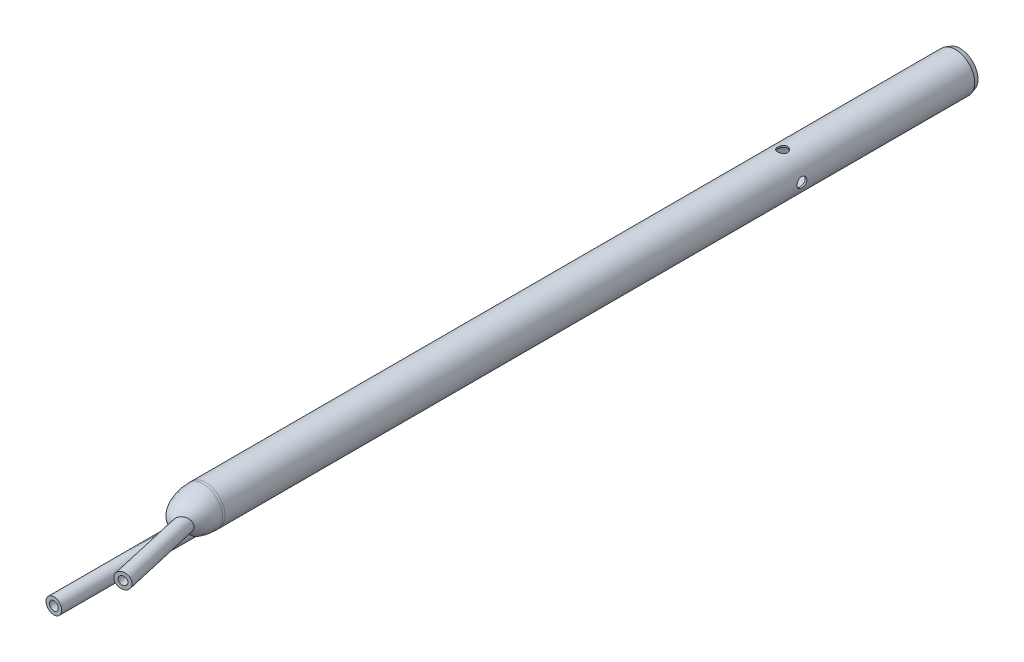
from build123d import *
from build123d.topology import SkipClean

# Parameters (mm, degrees)
SKETCH1_R               = 2.0066
SKETCH1_R_2             = 1.8415
BOSS_EXTRUDE1_DEPTH     = 77.724
CUT_EXTRUDE1_REACH      = 79.883
CUT_EXTRUDE1_END_RADIUS = 1.8415
SKETCH2_R               = 0.508
CIRPATTERN1_COUNT       = 4
SKETCH3_R               = 0.9271
SKETCH3_R_2             = 0.5715
BOSS_EXTRUDE2_DEPTH     = 77.724
CUT_EXTRUDE2_REACH      = 80.283
SKETCH6_R               = 0.5715
SKETCH7_R               = 0.8128
SKETCH7_R_2             = 0.4572
BOSS_EXTRUDE3_DEPTH     = 15.9766
SKETCH9_R               = 0.7874
SKETCH9_R_2             = 0.4318
SKETCH10_R              = 2.0066
BOSS_EXTRUDE4_DEPTH     = 0.254
DOME4_FACE_RADIUS       = 2.0066
DOME4_HEIGHT            = 3.302


# Read off the part's stored shape, not the designer's step: Loft1
with BuildPart() as part:
    # Sketch1 → Boss-Extrude1 (new body)
    with BuildSketch(Plane.XY):
        with Locations(Location((0, 0, 0), (0, 0, 180))):
            Circle(SKETCH1_R)
        with Locations(Location((0, 0, 0), (0, 0, 180))):
            Circle(SKETCH1_R_2, mode=Mode.SUBTRACT)
    extrude(amount=BOSS_EXTRUDE1_DEPTH)

    # Cut-Extrude1: up to this cylinder (the profile starts outside it)
    cut_extrude1_end = Plane(origin=(0, 0, 17.907), z_dir=(0, 0, -1)) * Cylinder(CUT_EXTRUDE1_END_RADIUS, 164.449, mode=Mode.PRIVATE)
    # Sketch2 → Cut-Extrude1 (cut, up to the surface)
    with BuildSketch(Plane(origin=(2.54, 0, 0), x_dir=(0, 0, -1), z_dir=(1, 0, 0)), mode=Mode.PRIVATE) as cut_extrude1_sk1:
        with Locations((-17.907, 0)):
            Circle(SKETCH2_R)
    cut_extrude1_tool1 = extrude(cut_extrude1_sk1.sketch, amount=-CUT_EXTRUDE1_REACH, mode=Mode.PRIVATE) - cut_extrude1_end
    cut_extrude1 = cut_extrude1_tool1.solids().sort_by_distance((2.54, 0, 17.907))[0]
    add(cut_extrude1, mode=Mode.SUBTRACT)

    # CirPattern1: Cut-Extrude1 ×4 about axis
    cirpattern1_axis = Axis((0, 0, 0), (0, 0, 1))
    for i in range(1, CIRPATTERN1_COUNT):
        add(cut_extrude1.rotate(cirpattern1_axis, i * 360 / CIRPATTERN1_COUNT), mode=Mode.SUBTRACT)



with BuildPart() as body_2:
    # Sketch3 → Boss-Extrude2 (new body)
    with BuildSketch(Plane.XY):
        Circle(SKETCH3_R)
        Circle(SKETCH3_R_2, mode=Mode.SUBTRACT)
    extrude(amount=BOSS_EXTRUDE2_DEPTH)


with BuildPart() as part_1:
    add(part.part)

    add(body_2.part)  # Loft1 merges body 2
    # Loft1 outline → Loft1 (revolve)
    with BuildSketch(Plane.XZ):
        Polygon((2.0066, 0), (0, 0), (0, -0.508), (1.8415, -0.508), align=None)
    revolve(axis=Axis((0, 0, 0), (0, 0, 1)))

    # Sketch6 → Cut-Extrude2 (cut, up to next)
    with BuildSketch(Plane(origin=(0, 0, -0.508), x_dir=(-1, 0, 0), z_dir=(0, 0, -1)), mode=Mode.PRIVATE) as cut_extrude2_sk1:
        Circle(SKETCH6_R)
    cut_extrude2_tool1 = extrude(cut_extrude2_sk1.sketch, amount=-CUT_EXTRUDE2_REACH, mode=Mode.PRIVATE) & part_1.part
    add(cut_extrude2_tool1.solids().sort_by_distance((0, 0, -0.508))[0], mode=Mode.SUBTRACT)

    # Sketch7 → Boss-Extrude3 (add)
    with SkipClean():  # the faces are left unmerged after this step: merging them gives an invalid solid
        with BuildSketch(Plane.XY.offset(77.724)):
            with Locations(Location((0.250410478, -0.966465499, 0), (0, 0, 165.078413954))):
                Circle(SKETCH7_R)
            with Locations(Location((0.250410478, -0.966465499, 0), (0, 0, 172.234948478))):
                Circle(SKETCH7_R_2, mode=Mode.SUBTRACT)
        extrude(amount=BOSS_EXTRUDE3_DEPTH)

    # Sweep1: sweep along a path in Sketch8
    with SkipClean():  # the faces are left unmerged after this step: merging them gives an invalid solid
        with BuildLine(Plane(origin=(0, 0, 0), x_dir=(1, 0, 0), z_dir=(0, 1, 0))) as sweep1_path:
            Line((0, -77.724), (2.54, -88.8238))
        # Sketch9 → Sweep1 (sweep)
        with BuildSketch(Plane(origin=(2.54, 0, 88.8238), x_dir=(0.9748030990707375, 0, -0.22306707072556928), z_dir=(0.22306707072556928, 0, 0.9748030990707375))):
            Circle(SKETCH9_R)
            Circle(SKETCH9_R_2, mode=Mode.SUBTRACT)
        sweep(path=sweep1_path.line)


with BuildPart() as body_2_2:
    # Sketch10 → Boss-Extrude4 (new body)
    with BuildSketch(Plane.XY.offset(77.724)):
        Circle(SKETCH10_R)
    extrude(amount=BOSS_EXTRUDE4_DEPTH)

    # Dome4: an elliptical dome of height H over a round flat face of radius A is half a spheroid: the quarter ellipse of half axes A and H revolved about the face's axis
    with BuildSketch(Plane((0, 0, 77.978), x_dir=(0, 1, 0), z_dir=(1, 0, 0)), mode=Mode.PRIVATE) as dome4_quarter:
        Ellipse(DOME4_FACE_RADIUS, DOME4_HEIGHT)
        Rectangle(DOME4_FACE_RADIUS, DOME4_HEIGHT, align=(Align.MIN, Align.MIN), mode=Mode.INTERSECT)
    revolve(dome4_quarter.sketch, axis=Axis((0, 0, 77.978), (0, 0, 1)))


solid = Compound([part_1.part, body_2_2.part])
